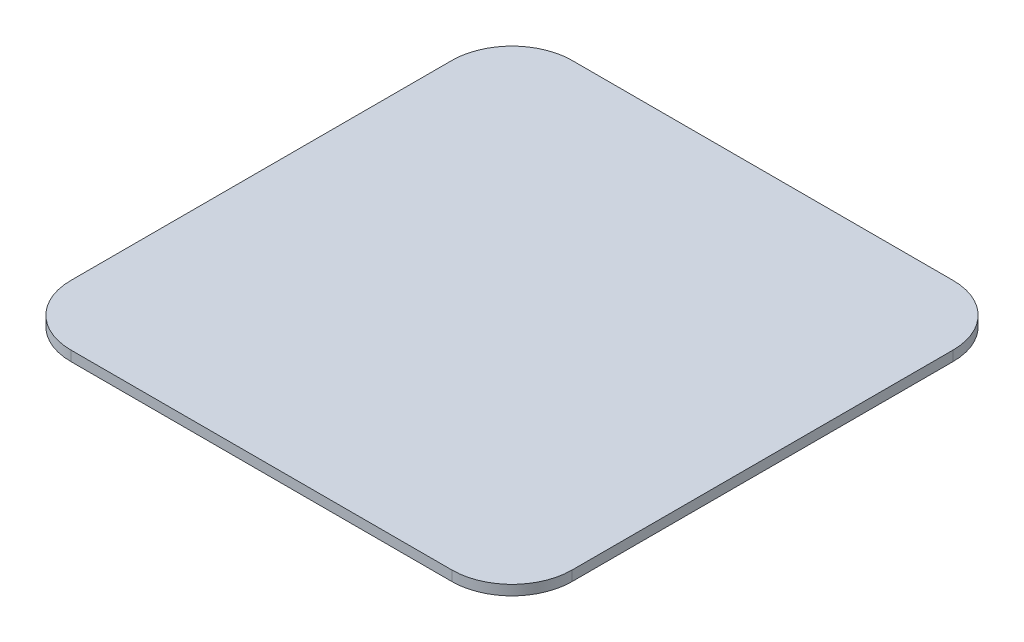
from build123d import *

# Parameters (mm, degrees)
BOSS_EXTRUDE1_DEPTH = 10


with BuildPart() as part:
    # Sketch1 → Boss-Extrude1 (new body)
    with BuildSketch(Plane(origin=(0, 0, 0), x_dir=(1, 0, 0), z_dir=(0, 1, 0))):
        with BuildLine():
            Line((-190, -250), (190, -250))
            ThreePointArc((190, -250), (232.426406871, -232.426406871), (250, -190))
            Line((250, -190), (250, 190))
            ThreePointArc((250, 190), (232.426406871, 232.426406871), (190, 250))
            Line((190, 250), (-190, 250))
            ThreePointArc((-190, 250), (-232.426406871, 232.426406871), (-250, 190))
            Line((-250, 190), (-250, -190))
            ThreePointArc((-250, -190), (-232.426406871, -232.426406871), (-190, -250))
        make_face()
    extrude(amount=BOSS_EXTRUDE1_DEPTH)


solid = part.part
